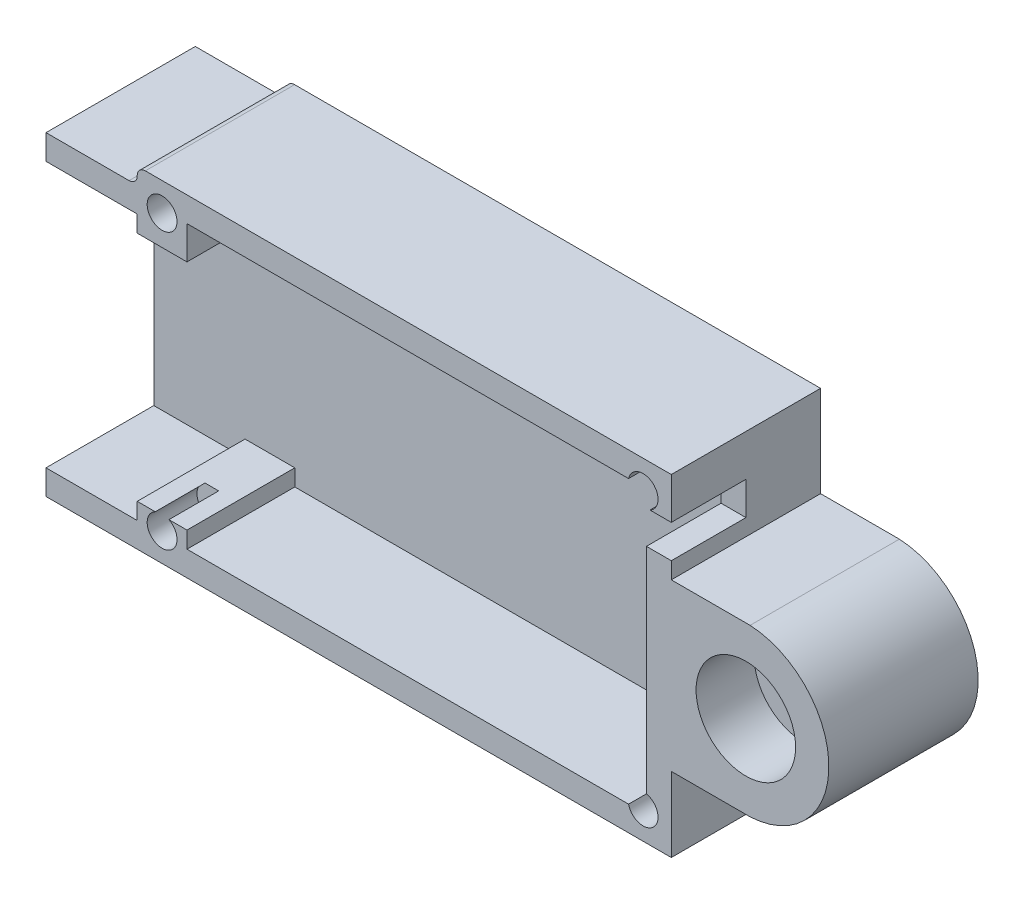
from build123d import *
from build123d.topology import SkipClean

# Parameters (mm, degrees)
SKETCH1_R                        = 1.75
BOSS_EXTRUDE1_DEPTH              = 7.5
SKETCH2_R                        = 1.75
BOSS_EXTRUDE2_DEPTH              = 2.5
SKETCH3_W                        = 1.5
SKETCH3_H                        = 2
CUT_EXTRUDE1_DEPTH               = 4.5
SKETCH4_R                        = 3
CUT_EXTRUDE2_DEPTH               = 3.5
M1_6_CLEARANCE_HOLE1_OUTLINE_R   = 0.9
M1_6_CLEARANCE_HOLE1_DEPTH       = 9
M1_6_START                       = 6
M1_6_CLEARANCE_HOLE1_2_OUTLINE_R = 0.9
M1_6_CLEARANCE_HOLE1_2_DEPTH     = 3


# Read off the part's stored shape, not the designer's step: M1.6 Clearance Hole1
with BuildPart() as part:
    # Sketch1 → Boss-Extrude1 (new body)
    with BuildSketch(Plane.XY.offset(1.5)):
        with BuildLine():
            Line((18.85, -9.5), (-18.85, -9.5))
            Line((-18.85, -9.5), (-18.85, -8))
            Line((-18.85, -8), (-13.35, -8))
            Line((-13.35, -8), (-13.35, -7))
            Line((-13.35, -7), (-10.35, -7))
            Line((-10.35, -7), (-10.35, -8))
            Line((-10.35, -8), (17.35, -8))
            Line((17.35, -8), (17.35, 9))
            Line((17.35, 9), (-10.35, 9))
            Line((-10.35, 9), (-10.35, 7))
            Line((-10.35, 7), (-13.35, 7))
            Line((-13.35, 7), (-13.35, 8))
            Line((-13.35, 8), (-13.84, 8))
            Line((-13.84, 8), (-18.85, 8))
            Line((-18.85, 8), (-18.85, 9.5))
            Line((-18.85, 9.5), (-13.84, 9.5))
            ThreePointArc((-13.84, 9.5), (-13.493517677, 9.643517677), (-13.35, 9.99))
            Line((-13.35, 9.99), (-13.35, 10.01))
            ThreePointArc((-13.35, 10.01), (-13.206482323, 10.356482323), (-12.86, 10.5))
            Line((-12.86, 10.5), (18.85, 10.5))
            Line((18.85, 10.5), (18.85, 9.5))
            Line((18.85, 9.5), (18.85, 5))
            Line((18.85, 5), (23.6, 5))
            ThreePointArc((23.6, 5), (28.35, 0), (23.6, -5))
            Line((23.6, -5), (18.85, -5))
            Line((18.85, -5), (18.85, -9.5))
        make_face()
        with Locations((23.343421053, 0)):
            Circle(SKETCH1_R, mode=Mode.SUBTRACT)
    extrude(amount=BOSS_EXTRUDE1_DEPTH)

    # Sketch2 → Boss-Extrude2 (add)
    with SkipClean():  # the faces are left unmerged after this step: merging them gives an invalid solid
        with BuildSketch(Plane.XY):
            with BuildLine():
                Line((-18.85, 8), (-18.85, -8))
                Line((-18.85, -8), (-18.85, -9.5))
                Line((-18.85, -9.5), (18.85, -9.5))
                Line((18.85, -9.5), (18.85, -5))
                Line((18.85, -5), (23.6, -5))
                ThreePointArc((23.6, -5), (28.35, 0), (23.6, 5))
                Line((23.6, 5), (18.85, 5))
                Line((18.85, 5), (18.85, 10.5))
                Line((18.85, 10.5), (-12.86, 10.5))
                ThreePointArc((-12.86, 10.5), (-13.206482323, 10.356482323), (-13.35, 10.01))
                Line((-13.35, 10.01), (-13.35, 9.99))
                ThreePointArc((-13.35, 9.99), (-13.493517677, 9.643517677), (-13.84, 9.5))
                Line((-13.84, 9.5), (-18.85, 9.5))
                Line((-18.85, 9.5), (-18.85, 8))
            make_face()
            with Locations((23.343421053, 0)):
                Circle(SKETCH2_R, mode=Mode.SUBTRACT)
        extrude(amount=BOSS_EXTRUDE2_DEPTH)
    add(part.part.scale(1), mode=Mode.REPLACE)  # the faces are merged on a copy

    # Sketch3 → Cut-Extrude1 (cut)
    with BuildSketch(Plane.XY.offset(9)):
        with Locations((18.1, 7)):
            Rectangle(SKETCH3_W, SKETCH3_H)
    extrude(amount=-CUT_EXTRUDE1_DEPTH, mode=Mode.SUBTRACT)

    # Sketch4 → Cut-Extrude2 (cut)
    with BuildSketch(Plane.XY.offset(9)):
        with Locations((23.343421053, 0)):
            Circle(SKETCH4_R)
    extrude(amount=-CUT_EXTRUDE2_DEPTH, mode=Mode.SUBTRACT)

    # M1.6 Clearance Hole1 outline → M1.6 Clearance Hole1 (cut)
    with BuildSketch(Plane.XY):
        with Locations((17.15, 8.8)):
            Circle(M1_6_CLEARANCE_HOLE1_OUTLINE_R)
        with Locations((17.15, -7.8)):
            Circle(M1_6_CLEARANCE_HOLE1_OUTLINE_R)
    extrude(amount=M1_6_CLEARANCE_HOLE1_DEPTH, mode=Mode.SUBTRACT)

    # M1.6 Clearance Hole1 2 outline → M1.6 Clearance Hole1 2 (cut)
    with BuildSketch(Plane.XY.offset(M1_6_START)):
        with BuildLine():
            Line((-11.437689437, -7), (-12.262310563, -7))
            ThreePointArc((-12.262310563, -7), (-11.85, -8.7), (-11.437689437, -7))
        make_face()
        with Locations((-11.85, 8.8)):
            Circle(M1_6_CLEARANCE_HOLE1_2_OUTLINE_R)
    extrude(amount=M1_6_CLEARANCE_HOLE1_2_DEPTH, mode=Mode.SUBTRACT)


solid = part.part
